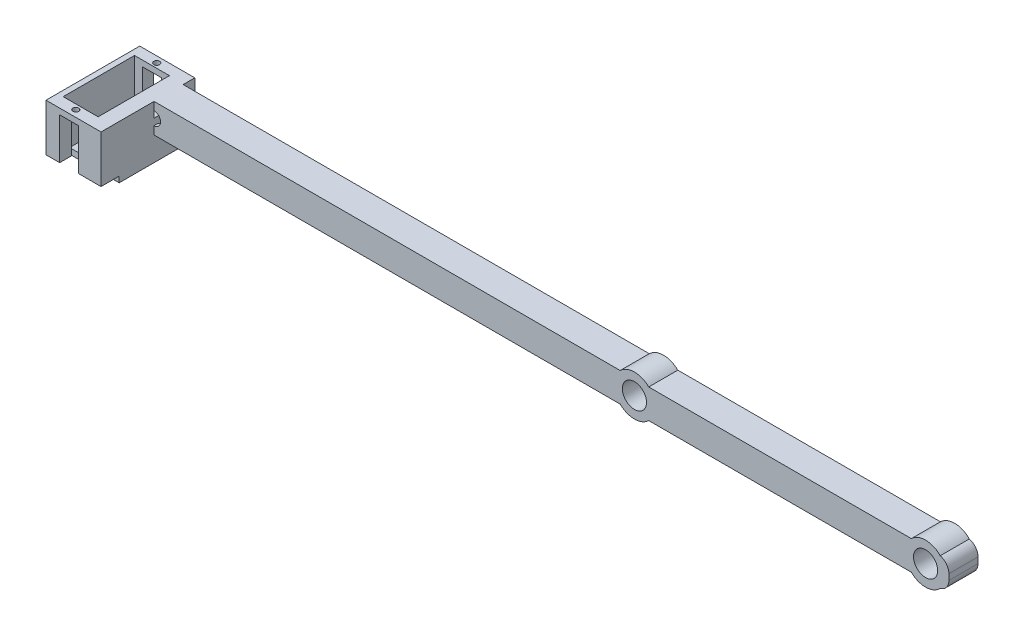
from build123d import *

# Parameters (mm, degrees)
SKETCH_1_R          = 2.25
SKETCH_1_R_2        = 1.75
EXTRUDE_1_DEPTH     = 10
SKETCH_3_W          = 7
SKETCH_3_H          = 7
CUT_EXTRUDE_1_DEPTH = 276.22717889
EXTRUDE_2_DEPTH     = 4
SKETCH_7_R          = 1
CUT_EXTRUDE_2_DEPTH = 2
SKETCH_8_W          = 6.516904704
SKETCH_8_H          = 4
CUT_EXTRUDE_3_DEPTH = 3
SKETCH_9_W          = 1.9
SKETCH_9_H          = 5
EXTRUDE_3_DEPTH     = 24.5
SKETCH_10_W         = 5
SKETCH_10_H         = 5
EXTRUDE_4_DEPTH     = 14.2
EXTRUDE_9_DEPTH     = 4
SKETCH_12_R         = 1
CUT_EXTRUDE_4_DEPTH = 3
EXTRUDE_10_DEPTH    = 11.25
SKETCH_14_W         = 18.9
SKETCH_14_H         = 20.745864208
EXTRUDE_13_DEPTH    = 2
SKETCH_15_W         = 12
SKETCH_15_H         = 0.3
CUT_EXTRUDE_5_DEPTH = 272.22739998
SKETCH_16_W         = 16
SKETCH_16_H         = 10
EXTRUDE_14_DEPTH    = 10
FILLET_1_R          = 4
SKETCH_17_R         = 4.04
CUT_EXTRUDE_7_DEPTH = 10
SKETCH_20_R         = 7
SKETCH_20_R_2       = 4.04
EXTRUDE_15_DEPTH    = 10
FILLET_3_R          = 3.5
SKETCH_21_R         = 4.15
CUT_EXTRUDE_8_DEPTH = 10


with BuildPart() as part:
    # 草图1 → 凸台-拉伸1 (new body)
    with BuildSketch(Plane.XY):
        with BuildLine():
            Line((265, 5), (-5, 5))
            Line((-5, 5), (-5, -5))
            Line((-5, -5), (265, -5))
            ThreePointArc((265, -5), (270, 0), (265, 5))
        make_face()
        Circle(SKETCH_1_R, mode=Mode.SUBTRACT)
        with Locations((165, 0)):
            Circle(SKETCH_1_R_2, mode=Mode.SUBTRACT)
        with Locations((265, 0)):
            Circle(SKETCH_1_R_2, mode=Mode.SUBTRACT)
    extrude(amount=-EXTRUDE_1_DEPTH)

    # 草图3 → 切除-拉伸1 (cut, through all)
    with BuildSketch(Plane.ZY.offset(5)):
        with Locations((-5, 0)):
            Rectangle(SKETCH_3_W, SKETCH_3_H)
    extrude(amount=-CUT_EXTRUDE_1_DEPTH, mode=Mode.SUBTRACT)

    # 草图5 → 凸台-拉伸2 (add)
    with BuildSketch(Plane(origin=(0, 0, -10), x_dir=(-1, 0, 0), z_dir=(0, 0, -1))):
        Polygon((5, 5), (18.9, 5), (18.9, 0), (0, 0), (0, 5), align=None)
    extrude(amount=EXTRUDE_2_DEPTH)

    # 草图7 → 切除-拉伸2 (cut)
    with BuildSketch(Plane(origin=(0, 5, 0), x_dir=(1, 0, 0), z_dir=(0, 1, 0))):
        with Locations(Location((-10.95, 11.9, 0), (0, 0, 180))):
            Circle(SKETCH_7_R)
    extrude(amount=-CUT_EXTRUDE_2_DEPTH, mode=Mode.SUBTRACT)

    # 草图8 → 切除-拉伸3 (cut)
    with BuildSketch(Plane.XZ):
        with Locations((-10.951938586, -12)):
            Rectangle(SKETCH_8_W, SKETCH_8_H)
    extrude(amount=-CUT_EXTRUDE_3_DEPTH, mode=Mode.SUBTRACT)

    # 草图9 → 凸台-拉伸3 (add)
    with BuildSketch(Plane.XY.offset(-10)):
        with Locations((-17.95, 2.5)):
            Rectangle(SKETCH_9_W, SKETCH_9_H)
    extrude(amount=EXTRUDE_3_DEPTH)

    # 草图10 → 凸台-拉伸4 (add)
    with BuildSketch(Plane.XY):
        with Locations((-2.5, 2.5)):
            Rectangle(SKETCH_10_W, SKETCH_10_H)
    extrude(amount=EXTRUDE_4_DEPTH)

    # 草图11 → 凸台-拉伸9 (add)
    with BuildSketch(Plane.XY.offset(14.2)):
        Polygon((0, 0), (-7.693486234, 0), (-7.693486234, 3), (-14.210390938, 3), (-14.210390938, 0), (-18.9, 0), (-18.9, 5), (0, 5), align=None)
    extrude(amount=EXTRUDE_9_DEPTH)

    # 草图12 → 切除-拉伸4 (cut)
    with BuildSketch(Plane(origin=(0, 5, 0), x_dir=(1, 0, 0), z_dir=(0, 1, 0))):
        with Locations(Location((-10.95, -15.9, 0), (0, 0, 180))):
            Circle(SKETCH_12_R)
    extrude(amount=-CUT_EXTRUDE_4_DEPTH, mode=Mode.SUBTRACT)

    # 草图13 → 凸台-拉伸10 (add)
    with BuildSketch(Plane.XZ):
        Polygon((-14.210390938, -14), (-14.210390938, -10), (-17, -10), (-17, 14.2), (-14.210390938, 14.2), (-14.210390938, 18.2), (-18.9, 18.2), (-18.9, -14), align=None)
        Polygon((-7.693486234, -14), (0, -14), (0, -10), (0, 18.2), (-7.693486234, 18.2), (-7.693486234, 14.2), (-5, 14.2), (-5, -10), (-7.693486234, -10), align=None)
    extrude(amount=EXTRUDE_10_DEPTH)

    # 草图14 → 凸台-拉伸13 (add)
    with BuildSketch(Plane(origin=(0, -11.25, 0), x_dir=(-1, 0, 0), z_dir=(0, -1, 0))):
        with Locations((9.45, -1.594289746)):
            Rectangle(SKETCH_14_W, SKETCH_14_H)
    extrude(amount=EXTRUDE_13_DEPTH)

    # 草图15 → 切除-拉伸5 (cut, through all)
    with BuildSketch(Plane(origin=(0, 5, 0), x_dir=(1, 0, 0), z_dir=(0, 1, 0))):
        with Locations((-11, 10.15)):
            Rectangle(SKETCH_15_W, SKETCH_15_H)
    extrude(amount=-CUT_EXTRUDE_5_DEPTH, mode=Mode.SUBTRACT)

    # 草图16 → 凸台-拉伸14 (add)
    with BuildSketch(Plane.XY):
        with Locations((165, 0)):
            Rectangle(SKETCH_16_W, SKETCH_16_H)
        with Locations((265, 0)):
            Rectangle(SKETCH_16_W, SKETCH_16_H)
    extrude(amount=-EXTRUDE_14_DEPTH)

    # 圆角1
    fillet_1_edges = [part.edges().sort_by_distance(p)[0] for p in [
        (273, -5, -5),
        (273, 5, -5),
    ]]
    fillet(fillet_1_edges, radius=FILLET_1_R)

    # 草图17 → 切除-拉伸7 (cut)
    with BuildSketch(Plane.XY):
        with Locations((165, 0)):
            Circle(SKETCH_17_R)
        with Locations((265, 0)):
            Circle(SKETCH_17_R)
    extrude(amount=-CUT_EXTRUDE_7_DEPTH, mode=Mode.SUBTRACT)

    # 草图20 → 凸台-拉伸15 (add)
    # profile 1 of 2: a face of its own
    with BuildSketch(Plane.XY):
        with Locations((165, 0)):
            Circle(SKETCH_20_R)
        with Locations((165, 0)):
            Circle(SKETCH_20_R_2, mode=Mode.SUBTRACT)
    # profile 2 of 2: a face of its own
    with BuildSketch(Plane.XY):
        with Locations((265, 0)):
            Circle(SKETCH_20_R)
        with Locations((265, 0)):
            Circle(SKETCH_20_R_2, mode=Mode.SUBTRACT)
    extrude(amount=-EXTRUDE_15_DEPTH)

    # 圆角3
    # the kernel refuses this fillet: 3.5 mm, written as the material it adds along each edge
    with BuildSketch(Plane(origin=(-5, 3.5, -8.5), x_dir=(0, -1, 0), z_dir=(1, 0, 0))) as fillet_3_piece_1_section:
        with BuildLine():
            CenterArc((FILLET_3_R, -FILLET_3_R), FILLET_3_R, 90, 90)
            Line((0, -FILLET_3_R), (0, 0))
            Line((0, 0), (FILLET_3_R, 0))
        make_face()
    fillet_3_piece_1 = extrude(amount=162, mode=Mode.PRIVATE)
    fillet_3_piece_1 = fillet_3_piece_1 - Plane(origin=(0, 0, -7.682274374), x_dir=(1, 0, 0), z_dir=(0, 0, 1)) * Cylinder(2.25, 339, mode=Mode.PRIVATE)
    add(fillet_3_piece_1)
    with BuildSketch(Plane(origin=(-5, 3.5, -1.5), x_dir=(0, -1, 0), z_dir=(1, 0, 0))) as fillet_3_piece_2_section:
        with BuildLine():
            CenterArc((FILLET_3_R, FILLET_3_R), FILLET_3_R, 180, 90)
            Line((0, FILLET_3_R), (0, 0))
            Line((0, 0), (FILLET_3_R, 0))
        make_face()
    fillet_3_piece_2 = extrude(amount=162, mode=Mode.PRIVATE)
    fillet_3_piece_2 = fillet_3_piece_2 - Plane(origin=(0, 0, -2.317725626), x_dir=(1, 0, 0), z_dir=(0, 0, 1)) * Cylinder(2.25, 339, mode=Mode.PRIVATE)
    add(fillet_3_piece_2)

    # 草图21 → 切除-拉伸8 (cut)
    with BuildSketch(Plane.XY):
        with Locations((165, 0)):
            Circle(SKETCH_21_R)
        with Locations((265, 0)):
            Circle(SKETCH_21_R)
    extrude(amount=-CUT_EXTRUDE_8_DEPTH, mode=Mode.SUBTRACT)


solid = part.part
